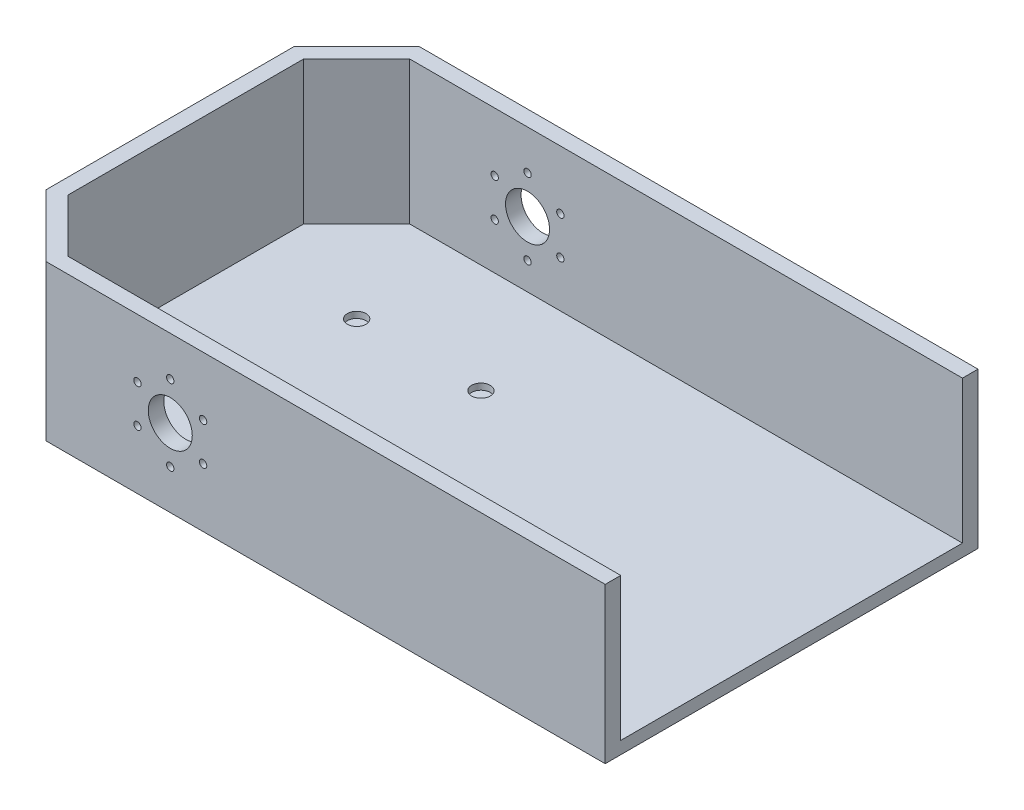
from build123d import *

# Parameters (mm, degrees)
SKETCH2_W           = 254
SKETCH2_H           = 152.4
BOSS_EXTRUDE1_DEPTH = 5.08
CHAMFER1_SIZE       = 25.4
BOSS_EXTRUDE3_DEPTH = 58.42
SKETCH5_R           = 9
SKETCH5_R_2         = 1.5
CUT_EXTRUDE1_DEPTH  = 209.295487229
SKETCH7_R           = 3.81
CUT_EXTRUDE2_DEPTH  = 2.54


with BuildPart() as part:
    # Sketch2 → Boss-Extrude1 (new body)
    with BuildSketch(Plane(origin=(0, 0, 0), x_dir=(1, 0, 0), z_dir=(0, 1, 0))):
        Rectangle(SKETCH2_W, SKETCH2_H)
    extrude(amount=BOSS_EXTRUDE1_DEPTH)

    # Chamfer1
    chamfer1_edges = [part.edges().sort_by_distance(p)[0] for p in [
        (-127, 2.54, -76.2),
        (-127, 2.54, 76.2),
    ]]
    chamfer(chamfer1_edges, length=CHAMFER1_SIZE)

    # Sketch4 → Boss-Extrude3 (add)
    with BuildSketch(Plane(origin=(0, 5.08, 0), x_dir=(1, 0, 0), z_dir=(0, 1, 0))):
        Polygon((120.65, 69.85), (-98.969743879, 69.85), (-120.65, 48.169743879), (-120.65, -48.169743879), (-98.969743879, -69.85), (120.65, -69.85), (127, -69.85), (127, -76.2), (-101.6, -76.2), (-127, -50.8), (-127, 50.8), (-101.6, 76.2), (127, 76.2), (127, 69.85), align=None)
    extrude(amount=BOSS_EXTRUDE3_DEPTH)

    # Sketch5 → Cut-Extrude1 (cut, through all)
    with BuildSketch(Plane.XY.offset(76.2)):
        with Locations((-50.8, 31.75)):
            Circle(SKETCH5_R)
        with Locations((-50.8, 47.25)):
            Circle(SKETCH5_R_2)
        with Locations((-37.376606241, 39.5)):
            Circle(SKETCH5_R_2)
        with Locations((-37.376606241, 24)):
            Circle(SKETCH5_R_2)
        with Locations((-50.8, 16.25)):
            Circle(SKETCH5_R_2)
        with Locations((-64.223393759, 24)):
            Circle(SKETCH5_R_2)
        with Locations((-64.223393759, 39.5)):
            Circle(SKETCH5_R_2)
    extrude(amount=-CUT_EXTRUDE1_DEPTH, mode=Mode.SUBTRACT)

    # Sketch7 → Cut-Extrude2 (cut)
    with BuildSketch(Plane(origin=(0, 5.08, 0), x_dir=(1, 0, 0), z_dir=(0, 1, 0))):
        with Locations((-76.2, 25.4)):
            Circle(SKETCH7_R)
        with Locations((-25.4, 25.4)):
            Circle(SKETCH7_R)
        with Locations((-25.4, -25.4)):
            Circle(SKETCH7_R)
        with Locations((-76.2, -25.4)):
            Circle(SKETCH7_R)
    extrude(amount=-CUT_EXTRUDE2_DEPTH, mode=Mode.SUBTRACT)


solid = part.part
